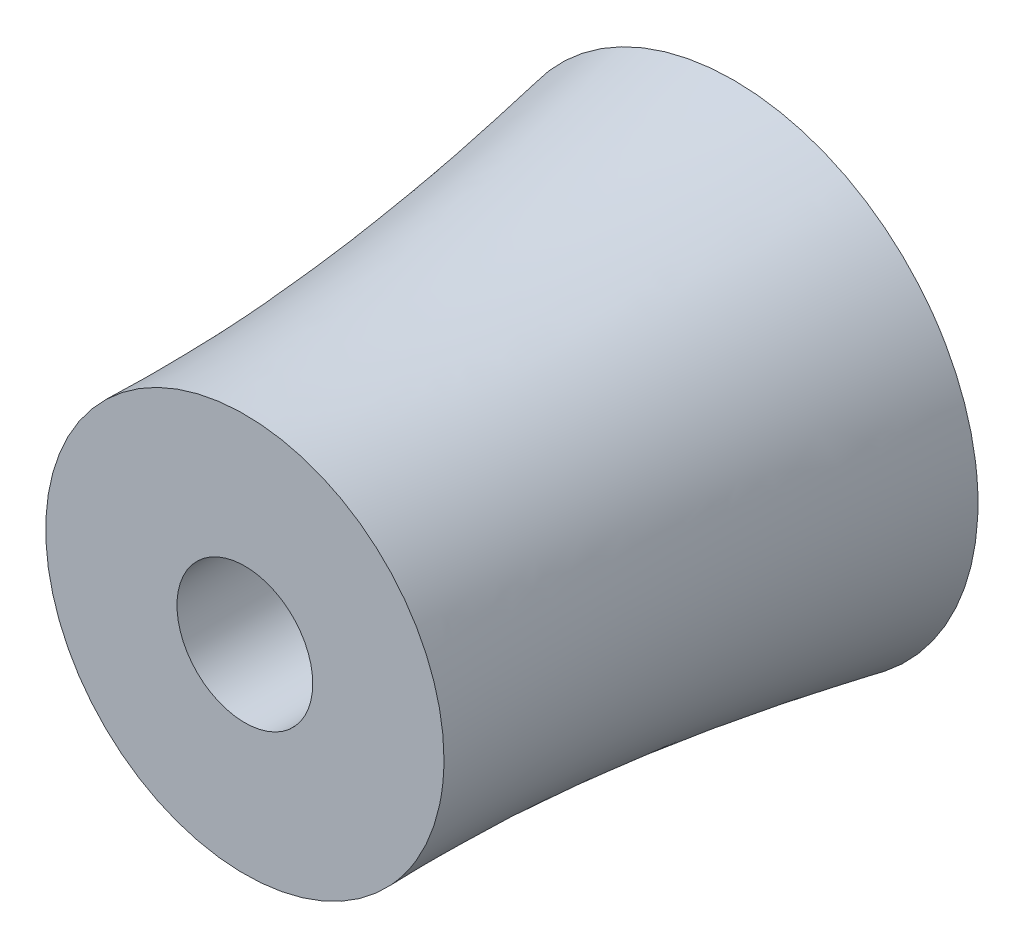
from build123d import *

# Parameters (mm, degrees)
ESQUISSE2_3_R           = 3.75
ENL_V_MAT_EXTRU_1_DEPTH = 34.068111691


with BuildPart() as part:
    # Lissage1: read off the stored shape, not the designer's step
    # Lissage1: loft between two sections, ruled curve by curve
    lissage1_from = [
        Edge.make_bspline([(-10.242734396, 4.010784473, 27), (-2.22116545, 24.496253265, 27), (18.264303342, 16.474684319, 27), (10.242734396, -4.010784473, 27), (2.22116545, -24.496253265, 27), (-18.264303342, -16.474684319, 27), (-10.242734396, 4.010784473, 27)], [0, 0, 0, 0, 0.5, 0.5, 0.5, 1, 1, 1, 1], 3, [1, 0.333333333, 0.333333333, 1, 0.333333333, 0.333333333, 1]),
    ]
    lissage1_to = [
        Edge.make_bspline([(-12.761121759, -4.404971221, 0), (-21.571064201, 21.117272296, 0), (3.951179317, 29.927214739, 0), (12.761121759, 4.404971221, 0), (21.571064201, -21.117272296, 0), (-3.951179317, -29.927214739, 0), (-12.761121759, -4.404971221, 0)], [0, 0, 0, 0, 0.5, 0.5, 0.5, 1, 1, 1, 1], 3, [1, 0.333333333, 0.333333333, 1, 0.333333333, 0.333333333, 1]),
    ]
    lissage1 = Solid(Shell([*[Face.make_surface_from_curves(lissage1_from[k], lissage1_to[k]) for k in range(1)], Face(Wire(lissage1_from)), Face(Wire(lissage1_to))]))
    add(lissage1)

    # Esquisse2<3> → Enlèv. mat.-Extru.1 (cut, through all)
    with BuildSketch(Plane.XY.offset(27)):
        Circle(ESQUISSE2_3_R)
    extrude(amount=-ENL_V_MAT_EXTRU_1_DEPTH, mode=Mode.SUBTRACT)


solid = part.part
